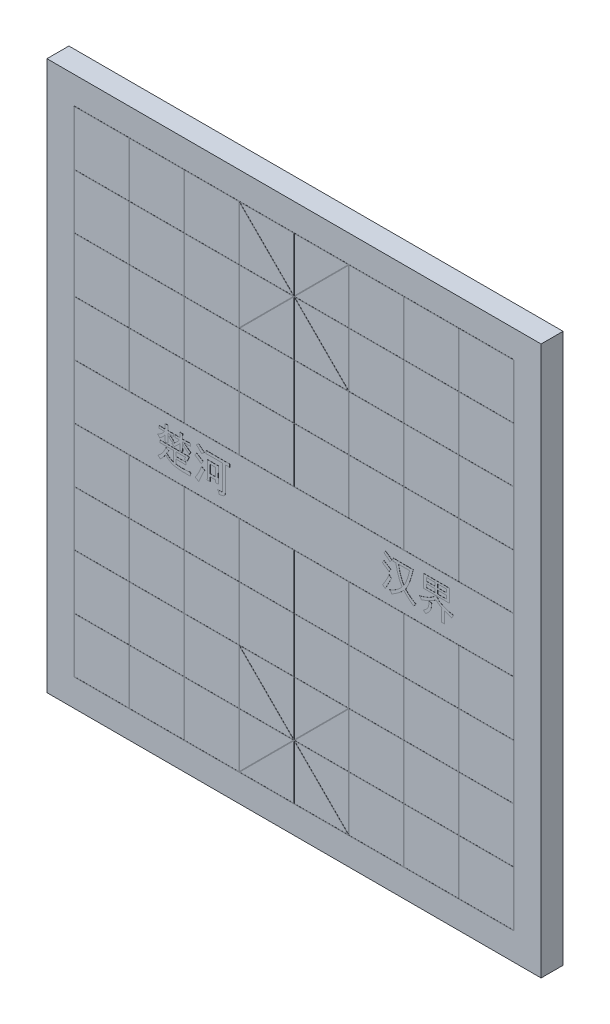
from build123d import *

# Parameters (mm, degrees)
SKETCH_1_W                  = 315
SKETCH_1_H                  = 350
BOARD315X350X14_DEPTH       = 14
SKETCH_2_W                  = 280
SKETCH_2_H                  = 0.32
TEN_RANKS_DEPTH             = 0.05
SKETCH_3_W                  = 0.32
SKETCH_3_H                  = 315
SKETCH_3_H_2                = 140
NINE_FILES_WITH_RIVER_DEPTH = 0.06
PALACE_DIAGONALS_1_DEPTH    = 0.07
PALACE_DIAGONALS_1_2_DEPTH  = 0.07
SKETCH_6_W                  = 3.368421053
SKETCH_6_H                  = 5.239766081
SKETCH_6_W_2                = 5.520467836
SKETCH_6_H_2                = 2.152046783
SKETCH_6_W_3                = 5.333333333
RIVER_NAME_DEPTH            = 0.09


with BuildPart() as part:
    # 草图1 → Board315x350x14 (new body)
    with BuildSketch(Plane.XY):
        Rectangle(SKETCH_1_W, SKETCH_1_H)
    extrude(amount=-BOARD315X350X14_DEPTH)

    # 草图2 → Ten_ranks (add)
    with BuildSketch(Plane.XY):
        with Locations((0, -157.5)):
            Rectangle(SKETCH_2_W, SKETCH_2_H)
        with Locations((0, -122.5)):
            Rectangle(SKETCH_2_W, SKETCH_2_H)
        with Locations((0, -87.5)):
            Rectangle(SKETCH_2_W, SKETCH_2_H)
        with Locations((0, -52.5)):
            Rectangle(SKETCH_2_W, SKETCH_2_H)
        with Locations((0, -17.5)):
            Rectangle(SKETCH_2_W, SKETCH_2_H)
        with Locations((0, 17.5)):
            Rectangle(SKETCH_2_W, SKETCH_2_H)
        with Locations((0, 52.5)):
            Rectangle(SKETCH_2_W, SKETCH_2_H)
        with Locations((0, 87.5)):
            Rectangle(SKETCH_2_W, SKETCH_2_H)
        with Locations((0, 122.5)):
            Rectangle(SKETCH_2_W, SKETCH_2_H)
        with Locations((0, 157.5)):
            Rectangle(SKETCH_2_W, SKETCH_2_H)
    extrude(amount=TEN_RANKS_DEPTH)

    # 草图3 → Nine_files_with_river (add)
    with BuildSketch(Plane.XY):
        with Locations((-140, 0)):
            Rectangle(SKETCH_3_W, SKETCH_3_H)
        with Locations((-105, -87.5)):
            Rectangle(SKETCH_3_W, SKETCH_3_H_2)
        with Locations((-105, 87.5)):
            Rectangle(SKETCH_3_W, SKETCH_3_H_2)
        with Locations((-70, -87.5)):
            Rectangle(SKETCH_3_W, SKETCH_3_H_2)
        with Locations((-70, 87.5)):
            Rectangle(SKETCH_3_W, SKETCH_3_H_2)
        with Locations((-35, -87.5)):
            Rectangle(SKETCH_3_W, SKETCH_3_H_2)
        with Locations((-35, 87.5)):
            Rectangle(SKETCH_3_W, SKETCH_3_H_2)
        with Locations((0, -87.5)):
            Rectangle(SKETCH_3_W, SKETCH_3_H_2)
        with Locations((0, 87.5)):
            Rectangle(SKETCH_3_W, SKETCH_3_H_2)
        with Locations((35, -87.5)):
            Rectangle(SKETCH_3_W, SKETCH_3_H_2)
        with Locations((35, 87.5)):
            Rectangle(SKETCH_3_W, SKETCH_3_H_2)
        with Locations((70, -87.5)):
            Rectangle(SKETCH_3_W, SKETCH_3_H_2)
        with Locations((70, 87.5)):
            Rectangle(SKETCH_3_W, SKETCH_3_H_2)
        with Locations((105, -87.5)):
            Rectangle(SKETCH_3_W, SKETCH_3_H_2)
        with Locations((105, 87.5)):
            Rectangle(SKETCH_3_W, SKETCH_3_H_2)
        with Locations((140, 0)):
            Rectangle(SKETCH_3_W, SKETCH_3_H)
    extrude(amount=NINE_FILES_WITH_RIVER_DEPTH)

    # 草图4 → Palace_diagonals_-1 (add)
    with BuildSketch(Plane.XY):
        Polygon((-34.88, -87.38), (35.12, -157.38), (34.88, -157.62), (-35.12, -87.62), align=None)
        Polygon((-34.88, 157.62), (35.12, 87.62), (34.88, 87.38), (-35.12, 157.38), align=None)
    extrude(amount=PALACE_DIAGONALS_1_DEPTH)

    # 草图5 → Palace_diagonals_1 2 (add)
    with BuildSketch(Plane.XY):
        Polygon((-34.88, -157.62), (35.12, -87.62), (34.88, -87.38), (-35.12, -157.38), align=None)
        Polygon((-34.88, 87.38), (35.12, 157.38), (34.88, 157.62), (-35.12, 87.62), align=None)
    extrude(amount=PALACE_DIAGONALS_1_2_DEPTH)

    # 草图6 → River_name (add)
    # profile 1 of 17: a face of its own
    with BuildSketch(Plane.XY):
        with BuildLine():
            add(Edge.make_bspline(
                [(-81.076023392, -4.538011696), (-80.918838992, -4.704279949), (-80.609895785, -5.031077313), (-80.113938961, -5.476849668), (-79.602153553, -5.875387865), (-79.072875726, -6.227058076), (-78.529933039, -6.532911545), (-77.983776496, -6.812454116), (-77.428812322, -7.052146489), (-77.052261693, -7.185379838), (-76.865497076, -7.251461988)],
                knots=[0, 0, 0, 0, 1.083854979, 2.130298131, 3.15622576, 4.1551638, 5.138259552, 6.107651827, 7.061417897, 8, 8, 8, 8], degree=3))
            Line((-76.865497076, -7.251461988), (-76.865497076, -0.795321637))
            Line((-76.865497076, -0.795321637), (-82.198830409, -0.795321637))
            add(Edge.make_bspline(
                [(-82.198830409, -0.795321637), (-82.425250764, -0.796952955), (-82.89316566, -0.800324198), (-83.618630967, -0.819044106), (-84.390444509, -0.845280571), (-84.920409319, -0.874077806), (-85.192982456, -0.888888889)],
                knots=[0, 0, 0, 0, 0.90691056, 1.874199695, 2.906651827, 4, 4, 4, 4], degree=3))
            Line((-85.192982456, -0.888888889), (-85.192982456, 0.701754386))
            add(Edge.make_bspline(
                [(-85.192982456, 0.701754386), (-84.717182231, 0.674894579), (-83.751079454, 0.620356283), (-82.78346659, 0.612283909), (-82.292397661, 0.608187135)],
                knots=[0, 0, 0, 0, 0.984988836, 2, 2, 2, 2], degree=3))
            Line((-82.292397661, 0.608187135), (-66.666666667, 0.608187135))
            add(Edge.make_bspline(
                [(-66.666666667, 0.608187135), (-66.76505846, 0.357245342), (-66.964039464, -0.150242609), (-67.266065071, -0.769404074), (-67.509984669, -1.287017822), (-67.678478207, -1.715653592), (-67.838157208, -2.177813477), (-67.929684983, -2.50098667), (-67.976608187, -2.666666667)],
                knots=[0, 0, 0, 0, 1.373075694, 2.776816742, 3.509105374, 4.288551293, 5.122597964, 6, 6, 6, 6], degree=3))
            add(Edge.make_bspline(
                [(-67.976608187, -2.666666667), (-68.129758153, -2.606438489), (-68.430468653, -2.48818025), (-68.881667404, -2.336401565), (-69.320724529, -2.206759319), (-69.611959942, -2.138597214), (-69.754385965, -2.105263158)],
                knots=[0, 0, 0, 0, 1.057928849, 2.077247046, 3.059695204, 4, 4, 4, 4], degree=3))
            add(Edge.make_bspline(
                [(-69.754385965, -2.105263158), (-69.692859522, -2.00907752), (-69.566417078, -1.811407272), (-69.40136835, -1.492807978), (-69.237241675, -1.155320261), (-69.146147176, -0.917384152), (-69.099415205, -0.795321637)],
                knots=[0, 0, 0, 0, 0.933170902, 1.917751207, 2.931795083, 4, 4, 4, 4], degree=3))
            Line((-69.099415205, -0.795321637), (-75.18128655, -0.795321637))
            Line((-75.18128655, -0.795321637), (-75.18128655, -3.415204678))
            Line((-75.18128655, -3.415204678), (-71.438596491, -3.415204678))
            add(Edge.make_bspline(
                [(-71.438596491, -3.415204678), (-71.001815612, -3.410863485), (-70.127717882, -3.402175771), (-69.25522659, -3.348494513), (-68.81871345, -3.321637427)],
                knots=[0, 0, 0, 0, 0.999386829, 2, 2, 2, 2], degree=3))
            Line((-68.81871345, -3.321637427), (-68.81871345, -4.912280702))
            add(Edge.make_bspline(
                [(-68.81871345, -4.912280702), (-69.247137009, -4.885431575), (-70.088451481, -4.832706745), (-70.931357328, -4.823320116), (-71.34502924, -4.81871345)],
                knots=[0, 0, 0, 0, 1.018462352, 2, 2, 2, 2], degree=3))
            Line((-71.34502924, -4.81871345), (-75.18128655, -4.81871345))
            Line((-75.18128655, -4.81871345), (-75.18128655, -7.625730994))
            add(Edge.make_bspline(
                [(-75.18128655, -7.625730994), (-74.889139051, -7.655750597), (-74.281114826, -7.718228099), (-73.333549315, -7.792324849), (-72.315851145, -7.858350306), (-71.421650745, -7.903477431), (-70.658960653, -7.923843707), (-70.040695614, -7.919240287), (-69.383246033, -7.89800223), (-68.688843216, -7.859635022), (-67.956366348, -7.803715962), (-67.185843011, -7.730175399), (-66.377029696, -7.640868711), (-65.82560029, -7.568922874), (-65.543859649, -7.532163743)],
                knots=[0, 0, 0, 0, 1.093655063, 2.276140567, 3.539214212, 4.891518649, 5.61012469, 6.38015826, 7.19360737, 8.059562295, 8.969847214, 9.929109227, 10.941924227, 12, 12, 12, 12], degree=3))
            add(Edge.make_bspline(
                [(-65.543859649, -7.532163743), (-65.60249192, -7.716393964), (-65.717807058, -8.078729125), (-65.853208531, -8.623563756), (-65.950695369, -9.157504086), (-65.991598383, -9.510679352), (-66.011695906, -9.684210526)],
                knots=[0, 0, 0, 0, 1.051050117, 2.067154947, 3.05030475, 4, 4, 4, 4], degree=3))
            add(Edge.make_bspline(
                [(-66.011695906, -9.684210526), (-66.339751677, -9.690453346), (-66.979662379, -9.702630688), (-67.917671846, -9.712664497), (-68.809476903, -9.717290165), (-69.657443801, -9.710757988), (-70.459120787, -9.692464786), (-71.217068412, -9.669921036), (-71.928621004, -9.634271005), (-72.597699006, -9.593984261), (-73.228525577, -9.541575399), (-73.828197678, -9.479401491), (-74.399176485, -9.407666503), (-74.939539589, -9.32320445), (-75.452361033, -9.23543077), (-75.934582415, -9.129677729), (-76.390278218, -9.021999629), (-76.947819019, -8.854856319), (-77.598904715, -8.626749516), (-78.333038351, -8.318132005), (-79.00728355, -7.97299931), (-79.629561535, -7.592170836), (-80.202006795, -7.166785188), (-80.742287273, -6.704509334), (-81.25933873, -6.206921602), (-81.573159267, -5.843566717), (-81.730994152, -5.660818713)],
                knots=[0, 0, 0, 0, 1.402670375, 2.736070708, 4.010139731, 5.215104651, 6.361036552, 7.438122247, 8.456592414, 9.406579707, 10.30346069, 11.16238365, 11.983761855, 12.763186773, 13.500371464, 14.207416242, 14.873343268, 15.501487313, 16.694697388, 17.821011009, 18.903201405, 19.929708892, 20.936148111, 21.948482172, 22.968196652, 24, 24, 24, 24], degree=3))
            add(Edge.make_bspline(
                [(-81.730994152, -5.660818713), (-81.827656686, -5.818910126), (-82.024459345, -6.140780545), (-82.354693502, -6.614540093), (-82.705746522, -7.100314443), (-83.093738735, -7.59296597), (-83.526690342, -8.097534915), (-84.022419511, -8.613733812), (-84.578476895, -9.151650595), (-84.983292076, -9.502482807), (-85.192982456, -9.684210526)],
                knots=[0, 0, 0, 0, 0.833832048, 1.697662549, 2.598246569, 3.531234619, 4.519242547, 5.589376796, 6.751320307, 8, 8, 8, 8], degree=3))
            add(Edge.make_bspline(
                [(-85.192982456, -9.684210526), (-85.304619884, -9.561407536), (-85.527327781, -9.31642522), (-85.890340476, -8.97520368), (-86.277784959, -8.659774116), (-86.552464234, -8.469554922), (-86.69005848, -8.374269006)],
                knots=[0, 0, 0, 0, 0.99797104, 1.990873804, 2.993574591, 4, 4, 4, 4], degree=3))
            add(Edge.make_bspline(
                [(-86.69005848, -8.374269006), (-86.543290334, -8.278977805), (-86.249010309, -8.087912526), (-85.829367551, -7.769597867), (-85.415778189, -7.439406064), (-85.027832379, -7.074901409), (-84.643474414, -6.699699925), (-84.280657785, -6.2967321), (-83.934019302, -5.871539438), (-83.487807301, -5.284959939), (-82.983561113, -4.520577811), (-82.447308343, -3.580719121), (-81.990480735, -2.622893805), (-81.754493628, -1.96419119), (-81.637426901, -1.637426901)],
                knots=[0, 0, 0, 0, 0.734038604, 1.471796874, 2.209156937, 2.953573237, 3.704213022, 4.462637796, 5.227279587, 6.005762103, 7.554503478, 9.065400907, 10.544225927, 12, 12, 12, 12], degree=3))
            add(Edge.make_bspline(
                [(-81.637426901, -1.637426901), (-81.504257504, -1.716311823), (-81.221707344, -1.883684716), (-80.758193197, -2.116050309), (-80.235636443, -2.348129804), (-79.865954316, -2.495819418), (-79.67251462, -2.573099415)],
                knots=[0, 0, 0, 0, 0.852125962, 1.807985404, 2.853007474, 4, 4, 4, 4], degree=3))
            add(Edge.make_bspline(
                [(-79.67251462, -2.573099415), (-79.796414966, -2.718624909), (-80.048094049, -3.01423121), (-80.405407854, -3.488551829), (-80.752616657, -3.996593104), (-80.966989693, -4.355477242), (-81.076023392, -4.538011696)],
                knots=[0, 0, 0, 0, 0.94820521, 1.926091625, 2.945175639, 4, 4, 4, 4], degree=3))
        make_face()
    # profile 2 of 17: a face of its own
    with BuildSketch(Plane.XY):
        with BuildLine():
            add(Edge.make_bspline(
                [(-72.65497076, 9.590643275), (-72.656691519, 9.707330816), (-72.660373026, 9.956979862), (-72.679138583, 10.354391901), (-72.705879969, 10.799354636), (-72.733828136, 11.110886282), (-72.748538012, 11.274853801)],
                knots=[0, 0, 0, 0, 0.829928519, 1.775603988, 2.829240308, 4, 4, 4, 4], degree=3))
            Line((-72.748538012, 11.274853801), (-70.877192982, 11.274853801))
            add(Edge.make_bspline(
                [(-70.877192982, 11.274853801), (-70.891974347, 11.122448187), (-70.920612959, 10.827165201), (-70.94737579, 10.393704127), (-70.965676506, 9.984703477), (-70.969105829, 9.718882854), (-70.970760234, 9.590643275)],
                knots=[0, 0, 0, 0, 1.088827181, 2.109582004, 3.088007521, 4, 4, 4, 4], degree=3))
            Line((-70.970760234, 9.590643275), (-70.970760234, 8.280701754))
            Line((-70.970760234, 8.280701754), (-68.912280702, 8.280701754))
            add(Edge.make_bspline(
                [(-68.912280702, 8.280701754), (-68.413138292, 8.285040755), (-67.414384424, 8.293722832), (-66.417036707, 8.347411877), (-65.918128655, 8.374269006)],
                knots=[0, 0, 0, 0, 0.999530368, 2, 2, 2, 2], degree=3))
            Line((-65.918128655, 8.374269006), (-65.918128655, 6.783625731))
            add(Edge.make_bspline(
                [(-65.918128655, 6.783625731), (-66.417036707, 6.81048286), (-67.414384424, 6.864171905), (-68.413138292, 6.872853982), (-68.912280702, 6.877192982)],
                knots=[0, 0, 0, 0, 1.000469632, 2, 2, 2, 2], degree=3))
            Line((-68.912280702, 6.877192982), (-70.970760234, 6.877192982))
            Line((-70.970760234, 6.877192982), (-70.970760234, 4.81871345))
            add(Edge.make_bspline(
                [(-70.970760234, 4.81871345), (-70.969263569, 4.512588109), (-70.966326481, 3.911841096), (-70.948197683, 3.02925847), (-70.922676273, 2.181139055), (-70.892166885, 1.628136773), (-70.877192982, 1.356725146)],
                knots=[0, 0, 0, 0, 1.060566986, 2.081279671, 3.058298631, 4, 4, 4, 4], degree=3))
            Line((-70.877192982, 1.356725146), (-72.748538012, 1.356725146))
            add(Edge.make_bspline(
                [(-72.748538012, 1.356725146), (-72.741947827, 1.483810257), (-72.729304985, 1.727614819), (-72.705829701, 2.076206875), (-72.694313178, 2.394110488), (-72.679362321, 2.679323013), (-72.668454712, 2.932301033), (-72.663216905, 3.153019988), (-72.653436281, 3.34120411), (-72.654494662, 3.456781158), (-72.65497076, 3.50877193)],
                knots=[0, 0, 0, 0, 1.417679315, 2.719726043, 3.89192347, 4.961278854, 5.901498894, 6.712645773, 7.42090111, 8, 8, 8, 8], degree=3))
            Line((-72.65497076, 3.50877193), (-72.65497076, 5.005847953))
            add(Edge.make_bspline(
                [(-72.65497076, 5.005847953), (-72.92509571, 4.734181886), (-73.446399853, 4.209903596), (-74.019430956, 3.609394938), (-74.392577235, 3.209938539), (-74.606968652, 2.997949836), (-74.843543315, 2.767817779), (-75.106083369, 2.519753247), (-75.392700744, 2.254203929), (-75.704739052, 1.968881548), (-76.044120901, 1.66969597), (-76.27756345, 1.46304121), (-76.397660819, 1.356725146)],
                knots=[0, 0, 0, 0, 2.197562491, 4.240994517, 4.761279205, 5.332914896, 5.970217027, 6.654562335, 7.404775425, 8.211559296, 9.079914855, 10, 10, 10, 10], degree=3))
            add(Edge.make_bspline(
                [(-76.397660819, 1.356725146), (-76.482697262, 1.466625103), (-76.65887358, 1.694313012), (-76.988624029, 1.999476103), (-77.367633939, 2.301938025), (-77.652450779, 2.480080999), (-77.801169591, 2.573099415)],
                knots=[0, 0, 0, 0, 0.890671052, 1.845269405, 2.874894574, 4, 4, 4, 4], degree=3))
            add(Edge.make_bspline(
                [(-77.801169591, 2.573099415), (-77.527393902, 2.728769519), (-76.990872877, 3.033837817), (-76.241026276, 3.54589692), (-75.538705126, 4.065921954), (-74.905811479, 4.615663257), (-74.337547662, 5.171941295), (-73.850079107, 5.734550151), (-73.440414971, 6.296013262), (-73.226375046, 6.687677458), (-73.122807018, 6.877192982)],
                knots=[0, 0, 0, 0, 1.172568205, 2.297893936, 3.379576269, 4.425894929, 5.41774288, 6.338988801, 7.196282396, 8, 8, 8, 8], degree=3))
            add(Edge.make_bspline(
                [(-73.122807018, 6.877192982), (-73.315730119, 6.875571039), (-73.713195503, 6.872229466), (-74.327771781, 6.853501668), (-74.977183758, 6.827431239), (-75.421609939, 6.798457905), (-75.649122807, 6.783625731)],
                knots=[0, 0, 0, 0, 0.915613415, 1.886371486, 2.917980746, 4, 4, 4, 4], degree=3))
            Line((-75.649122807, 6.783625731), (-75.649122807, 8.374269006))
            add(Edge.make_bspline(
                [(-75.649122807, 8.374269006), (-75.462034628, 8.359709162), (-75.119192849, 8.333028037), (-74.651196997, 8.306242718), (-74.276945771, 8.287021598), (-74.058493651, 8.282597127), (-73.964912281, 8.280701754)],
                knots=[0, 0, 0, 0, 1.334731458, 2.445914585, 3.334254831, 4, 4, 4, 4], degree=3))
            Line((-73.964912281, 8.280701754), (-72.65497076, 8.280701754))
            Line((-72.65497076, 8.280701754), (-72.65497076, 9.590643275))
        make_face()
    # profile 3 of 17: a face of its own
    with BuildSketch(Plane.XY):
        with BuildLine():
            Line((-82.011695906, 8.280701754), (-82.011695906, 9.684210526))
            add(Edge.make_bspline(
                [(-82.011695906, 9.684210526), (-82.013351728, 9.799745706), (-82.016813931, 10.041321451), (-82.035787719, 10.421405089), (-82.062128232, 10.836392416), (-82.09049704, 11.124757968), (-82.105263158, 11.274853801)],
                knots=[0, 0, 0, 0, 0.86982674, 1.818745106, 2.864645002, 4, 4, 4, 4], degree=3))
            Line((-82.105263158, 11.274853801), (-80.140350877, 11.274853801))
            add(Edge.make_bspline(
                [(-80.140350877, 11.274853801), (-80.170336771, 11.148200544), (-80.230718548, 10.893162337), (-80.28047026, 10.499433842), (-80.324133469, 10.096404764), (-80.326357056, 9.822963766), (-80.32748538, 9.684210526)],
                knots=[0, 0, 0, 0, 0.97210764, 1.957506618, 2.963569555, 4, 4, 4, 4], degree=3))
            Line((-80.32748538, 9.684210526), (-80.32748538, 8.280701754))
            Line((-80.32748538, 8.280701754), (-79.298245614, 8.280701754))
            add(Edge.make_bspline(
                [(-79.298245614, 8.280701754), (-78.869534204, 8.28476428), (-78.026562288, 8.292752393), (-77.185333639, 8.347409125), (-76.771929825, 8.374269006)],
                knots=[0, 0, 0, 0, 1.017142807, 2, 2, 2, 2], degree=3))
            Line((-76.771929825, 8.374269006), (-76.771929825, 6.783625731))
            add(Edge.make_bspline(
                [(-76.771929825, 6.783625731), (-76.998290057, 6.798397184), (-77.434651673, 6.826872571), (-78.06670864, 6.853395842), (-78.651252789, 6.872045793), (-79.025617313, 6.875527607), (-79.204678363, 6.877192982)],
                knots=[0, 0, 0, 0, 1.117897709, 2.155005972, 3.117527049, 4, 4, 4, 4], degree=3))
            Line((-79.204678363, 6.877192982), (-80.32748538, 6.877192982))
            Line((-80.32748538, 6.877192982), (-80.32748538, 3.134502924))
            add(Edge.make_bspline(
                [(-80.32748538, 3.134502924), (-80.325829716, 3.003953027), (-80.322370664, 2.731205053), (-80.303499382, 2.303760049), (-80.27735925, 1.841417847), (-80.248716956, 1.52184251), (-80.233918129, 1.356725146)],
                knots=[0, 0, 0, 0, 0.879753943, 1.838003015, 2.882944952, 4, 4, 4, 4], degree=3))
            Line((-80.233918129, 1.356725146), (-82.105263158, 1.356725146))
            add(Edge.make_bspline(
                [(-82.105263158, 1.356725146), (-82.090615051, 1.532252791), (-82.06326241, 1.860018341), (-82.036670161, 2.316502128), (-82.017479401, 2.702324698), (-82.01349162, 2.935800569), (-82.011695906, 3.040935673)],
                knots=[0, 0, 0, 0, 1.252731217, 2.339244833, 3.252155408, 4, 4, 4, 4], degree=3))
            Line((-82.011695906, 3.040935673), (-82.011695906, 5.192982456))
            add(Edge.make_bspline(
                [(-82.011695906, 5.192982456), (-82.109742748, 5.052275426), (-82.310323116, 4.764422524), (-82.642515791, 4.341427773), (-83.016834621, 3.924172252), (-83.418867172, 3.497495131), (-83.86747394, 3.069761809), (-84.358944813, 2.630948418), (-84.89654136, 2.178957296), (-85.277422016, 1.88332772), (-85.473684211, 1.730994152)],
                knots=[0, 0, 0, 0, 0.836953442, 1.712206395, 2.622878646, 3.572007085, 4.572859263, 5.646938937, 6.787502275, 8, 8, 8, 8], degree=3))
            add(Edge.make_bspline(
                [(-85.473684211, 1.730994152), (-85.570816563, 1.85419497), (-85.766127579, 2.101923727), (-86.102578282, 2.442065064), (-86.472984766, 2.758031412), (-86.741586896, 2.946025331), (-86.877192982, 3.040935673)],
                knots=[0, 0, 0, 0, 0.97539016, 1.961287235, 2.970738395, 4, 4, 4, 4], degree=3))
            add(Edge.make_bspline(
                [(-86.877192982, 3.040935673), (-86.675079659, 3.153392315), (-86.270168307, 3.378686574), (-85.680794668, 3.752386899), (-85.100965392, 4.151407091), (-84.528424746, 4.580094969), (-83.973316789, 5.059047299), (-83.445614054, 5.60341883), (-82.941388114, 6.210576569), (-82.635676778, 6.651822794), (-82.479532164, 6.877192982)],
                knots=[0, 0, 0, 0, 0.940808752, 1.88480471, 2.83770753, 3.8039367, 4.793350854, 5.816940978, 6.8849844, 8, 8, 8, 8], degree=3))
            Line((-82.479532164, 6.877192982), (-83.789473684, 6.877192982))
            add(Edge.make_bspline(
                [(-83.789473684, 6.877192982), (-83.939656981, 6.875480856), (-84.259741031, 6.87183182), (-84.768040971, 6.853081514), (-85.335397518, 6.826270245), (-85.732488149, 6.798332453), (-85.941520468, 6.783625731)],
                knots=[0, 0, 0, 0, 0.8365234, 1.782873351, 2.832883257, 4, 4, 4, 4], degree=3))
            Line((-85.941520468, 6.783625731), (-85.941520468, 8.374269006))
            add(Edge.make_bspline(
                [(-85.941520468, 8.374269006), (-85.683965972, 8.359478794), (-85.185198539, 8.330836794), (-84.459590561, 8.304390294), (-83.78148173, 8.285776445), (-83.34475154, 8.282350876), (-83.134502924, 8.280701754)],
                knots=[0, 0, 0, 0, 1.102078905, 2.134232082, 3.101790691, 4, 4, 4, 4], degree=3))
            Line((-83.134502924, 8.280701754), (-82.011695906, 8.280701754))
        make_face()
    # profile 4 of 17: a face of its own
    with BuildSketch(Plane.XY):
        with BuildLine():
            add(Edge.make_bspline(
                [(-69.754385965, 6.502923977), (-69.415537986, 6.229348739), (-68.750730898, 5.692604333), (-67.749927692, 4.911665634), (-66.746203105, 4.157735052), (-66.071142944, 3.663991698), (-65.730994152, 3.415204678)],
                knots=[0, 0, 0, 0, 1.030286493, 2.021383645, 3.003016322, 4, 4, 4, 4], degree=3))
            add(Edge.make_bspline(
                [(-65.730994152, 3.415204678), (-65.9107426, 3.174291186), (-66.257687191, 2.709287821), (-66.596808092, 2.238549508), (-66.760233918, 2.011695906)],
                knots=[0, 0, 0, 0, 1.036179567, 2, 2, 2, 2], degree=3))
            add(Edge.make_bspline(
                [(-66.760233918, 2.011695906), (-66.969122685, 2.189814766), (-67.369558643, 2.531265372), (-67.944228493, 3.015136785), (-68.470635657, 3.44252109), (-69.101835874, 3.947882713), (-69.868408236, 4.555468473), (-70.475358573, 5.040304049), (-70.783625731, 5.286549708)],
                knots=[0, 0, 0, 0, 0.952436521, 1.825803449, 2.606337136, 3.304847205, 4.631144853, 6, 6, 6, 6], degree=3))
            add(Edge.make_bspline(
                [(-70.783625731, 5.286549708), (-70.604212722, 5.496478841), (-70.259136708, 5.900248383), (-69.918106616, 6.307440479), (-69.754385965, 6.502923977)],
                knots=[0, 0, 0, 0, 1.039846303, 2, 2, 2, 2], degree=3))
        make_face()
    # profile 5 of 17: a face of its own
    with BuildSketch(Plane.XY):
        with BuildLine():
            add(Edge.make_bspline(
                [(-78.736842105, 6.315789474), (-78.574354004, 6.158161709), (-78.241402357, 5.835169296), (-77.695261005, 5.367434655), (-77.104613236, 4.875766171), (-76.70104996, 4.530427015), (-76.49122807, 4.350877193)],
                knots=[0, 0, 0, 0, 0.909958287, 1.864580294, 2.889745856, 4, 4, 4, 4], degree=3))
            add(Edge.make_bspline(
                [(-76.49122807, 4.350877193), (-76.600076242, 4.28482366), (-76.820221711, 4.151230365), (-77.129852537, 3.90782721), (-77.427636544, 3.63067594), (-77.613183877, 3.425860663), (-77.707602339, 3.321637427)],
                knots=[0, 0, 0, 0, 0.953760315, 1.92898059, 2.946131614, 4, 4, 4, 4], degree=3))
            add(Edge.make_bspline(
                [(-77.707602339, 3.321637427), (-77.812693809, 3.425626169), (-78.014173036, 3.624991269), (-78.303803964, 3.910757888), (-78.575540187, 4.162294273), (-78.900120543, 4.464202929), (-79.310963862, 4.799445582), (-79.677131392, 4.999631634), (-79.859649123, 5.099415205)],
                knots=[0, 0, 0, 0, 0.949162292, 1.819714617, 2.611979086, 3.325844628, 4.667056119, 6, 6, 6, 6], degree=3))
            add(Edge.make_bspline(
                [(-79.859649123, 5.099415205), (-79.670717453, 5.292975614), (-79.28514623, 5.687993157), (-78.922029812, 6.103753571), (-78.736842105, 6.315789474)],
                knots=[0, 0, 0, 0, 0.980009181, 2, 2, 2, 2], degree=3))
        make_face()
    # profile 6 of 17: a face of its own
    with BuildSketch(Plane.XY):
        with BuildLine():
            add(Edge.make_bspline(
                [(-48.140350877, 4.912280702), (-48.14730627, 4.754027608), (-48.16202789, 4.419072842), (-48.184902119, 3.886669546), (-48.195572354, 3.296213316), (-48.211155535, 2.647081308), (-48.221111816, 1.940098554), (-48.226621843, 1.174210363), (-48.235955075, 0.349451546), (-48.234612534, -0.220053387), (-48.233918129, -0.514619883)],
                knots=[0, 0, 0, 0, 0.700374111, 1.482395324, 2.355986645, 3.311274716, 4.35328148, 5.482046318, 6.697632363, 8, 8, 8, 8], degree=3))
            add(Edge.make_bspline(
                [(-48.233918129, -0.514619883), (-48.234635665, -0.80456594), (-48.236005013, -1.357899425), (-48.226778802, -2.146849422), (-48.221211063, -2.85498064), (-48.211543654, -3.481118205), (-48.196063842, -4.025123302), (-48.18537245, -4.487417654), (-48.163790435, -4.867402947), (-48.147501739, -5.093655754), (-48.140350877, -5.192982456)],
                knots=[0, 0, 0, 0, 1.486826903, 2.837462664, 4.045937822, 5.118259066, 6.048568124, 6.836764901, 7.489330947, 8, 8, 8, 8], degree=3))
            Line((-48.140350877, -5.192982456), (-50.011695906, -5.192982456))
            Line((-50.011695906, -5.192982456), (-50.011695906, -3.695906433))
            Line((-50.011695906, -3.695906433), (-53.380116959, -3.695906433))
            Line((-53.380116959, -3.695906433), (-53.380116959, -6.409356725))
            Line((-53.380116959, -6.409356725), (-55.251461988, -6.409356725))
            add(Edge.make_bspline(
                [(-55.251461988, -6.409356725), (-55.235393696, -6.299742252), (-55.198464107, -6.047816451), (-55.164096985, -5.617325747), (-55.134546432, -5.08692129), (-55.10493523, -4.457404106), (-55.092544025, -3.729390509), (-55.070878372, -2.902427878), (-55.067664676, -1.975882021), (-55.065476092, -1.324377108), (-55.064327485, -0.98245614)],
                knots=[0, 0, 0, 0, 0.489231648, 1.124395993, 1.906390679, 2.835898043, 3.907675587, 5.122280597, 6.489723435, 8, 8, 8, 8], degree=3))
            add(Edge.make_bspline(
                [(-55.064327485, -0.98245614), (-55.063615217, -0.631287627), (-55.062251582, 0.041023561), (-55.071520775, 1.004404225), (-55.077064825, 1.877717851), (-55.086789282, 2.659789744), (-55.102417201, 3.351665318), (-55.112941313, 3.952525958), (-55.135129865, 4.463022129), (-55.150812574, 4.772516141), (-55.157894737, 4.912280702)],
                knots=[0, 0, 0, 0, 1.429417562, 2.736616134, 3.921565378, 4.984318107, 5.920211374, 6.738581004, 7.430355148, 8, 8, 8, 8], degree=3))
            Line((-55.157894737, 4.912280702), (-48.140350877, 4.912280702))
        make_face()
        with Locations((-51.695906433, 0.608187135)):
            Rectangle(SKETCH_6_W, SKETCH_6_H, mode=Mode.SUBTRACT)
    # profile 7 of 17: a face of its own
    with BuildSketch(Plane.XY):
        with BuildLine():
            add(Edge.make_bspline(
                [(-43.555555556, 9.497076023), (-43.348771152, 9.498678804), (-42.927051599, 9.501947541), (-42.283585997, 9.520411985), (-41.616847224, 9.546645446), (-41.165495495, 9.575798754), (-40.935672515, 9.590643275)],
                knots=[0, 0, 0, 0, 0.946389898, 1.930083307, 2.946022819, 4, 4, 4, 4], degree=3))
            Line((-40.935672515, 9.590643275), (-40.935672515, 7.719298246))
            add(Edge.make_bspline(
                [(-40.935672515, 7.719298246), (-41.216337787, 7.733988246), (-41.746350504, 7.761729075), (-42.495019932, 7.78837926), (-43.150005297, 7.807335896), (-43.555545317, 7.811119483), (-43.742690058, 7.812865497)],
                knots=[0, 0, 0, 0, 1.20068751, 2.267397185, 3.200454974, 4, 4, 4, 4], degree=3))
            Line((-43.742690058, 7.812865497), (-43.742690058, -8))
            add(Edge.make_bspline(
                [(-43.742690058, -8), (-43.744754316, -8.112231929), (-43.74871002, -8.32730013), (-43.794939739, -8.633977673), (-43.866296484, -8.910250145), (-43.967421666, -9.157105369), (-44.097993757, -9.374989652), (-44.265694473, -9.557105223), (-44.457288449, -9.712577757), (-44.68276333, -9.833430021), (-44.936195766, -9.936594275), (-45.219638242, -10.031331923), (-45.53370935, -10.126043184), (-45.880728535, -10.215186889), (-46.2595803, -10.301651482), (-46.671335108, -10.380657872), (-47.113858067, -10.456843021), (-47.42059546, -10.502661955), (-47.578947368, -10.526315789)],
                knots=[0, 0, 0, 0, 1.040886063, 1.99463287, 2.871059874, 3.683434383, 4.46309974, 5.214611699, 5.969785871, 6.742490452, 7.578780862, 8.507799969, 9.51523784, 10.623051707, 11.832511428, 13.121477588, 14.513974723, 16, 16, 16, 16], degree=3))
            add(Edge.make_bspline(
                [(-47.578947368, -10.526315789), (-47.590087699, -10.446304881), (-47.612906449, -10.282418462), (-47.678653475, -10.035031378), (-47.763186922, -9.777195283), (-47.884857087, -9.51431701), (-48.026984503, -9.240217672), (-48.193101242, -8.955795709), (-48.387551577, -8.664219749), (-48.533185464, -8.47283331), (-48.608187135, -8.374269006)],
                knots=[0, 0, 0, 0, 0.80235467, 1.643463825, 2.54041336, 3.496498953, 4.518579014, 5.609675789, 6.768979442, 8, 8, 8, 8], degree=3))
            add(Edge.make_bspline(
                [(-48.608187135, -8.374269006), (-48.444182856, -8.382089184), (-48.132434967, -8.396954185), (-47.68754469, -8.404404457), (-47.290180114, -8.415149681), (-46.938981689, -8.40876605), (-46.634920765, -8.405337327), (-46.377085918, -8.387614384), (-46.166525774, -8.36431978), (-45.995509628, -8.335787786), (-45.855825827, -8.286086879), (-45.738529137, -8.211559419), (-45.640051146, -8.111759655), (-45.557715984, -7.987785519), (-45.503050792, -7.836219117), (-45.454861754, -7.664205437), (-45.43436821, -7.46560864), (-45.429478889, -7.325399187), (-45.426900585, -7.251461988)],
                knots=[0, 0, 0, 0, 1.999754923, 3.801238509, 5.419559242, 6.840721775, 8.079221447, 9.122792232, 9.986708725, 10.660024564, 11.229825311, 11.780185239, 12.337337785, 12.926609892, 13.577196232, 14.290488722, 15.098516731, 16, 16, 16, 16], degree=3))
            Line((-45.426900585, -7.251461988), (-45.426900585, 7.812865497))
            Line((-45.426900585, 7.812865497), (-52.725146199, 7.812865497))
            add(Edge.make_bspline(
                [(-52.725146199, 7.812865497), (-52.982754517, 7.811243898), (-53.513038891, 7.807905851), (-54.332069726, 7.789223845), (-55.197436209, 7.763025021), (-55.789801067, 7.734120537), (-56.093567251, 7.719298246)],
                knots=[0, 0, 0, 0, 0.91729495, 1.888243292, 2.917085867, 4, 4, 4, 4], degree=3))
            Line((-56.093567251, 7.719298246), (-56.093567251, 9.590643275))
            add(Edge.make_bspline(
                [(-56.093567251, 9.590643275), (-55.789801067, 9.575820983), (-55.197436209, 9.546916499), (-54.332069726, 9.520717676), (-53.513038891, 9.50203567), (-52.982754517, 9.498697623), (-52.725146199, 9.497076023)],
                knots=[0, 0, 0, 0, 1.082914133, 2.111756708, 3.08270505, 4, 4, 4, 4], degree=3))
            Line((-52.725146199, 9.497076023), (-43.555555556, 9.497076023))
        make_face()
    # profile 8 of 17: a face of its own
    with BuildSketch(Plane.XY):
        with BuildLine():
            add(Edge.make_bspline(
                [(-56.842105263, -1.918128655), (-56.921248162, -2.048310714), (-57.084798701, -2.317334798), (-57.32629734, -2.740858032), (-57.576709816, -3.193834878), (-57.828359625, -3.682133644), (-58.09351773, -4.198265104), (-58.353630959, -4.752599304), (-58.630681633, -5.333373276), (-58.900366991, -5.941114248), (-59.17028551, -6.548881987), (-59.430355626, -7.136285977), (-59.671969095, -7.695151307), (-59.902701203, -8.223342226), (-60.115961351, -8.724214413), (-60.316719923, -9.195612546), (-60.505671383, -9.635639512), (-60.622154286, -9.920851705), (-60.678362573, -10.058479532)],
                knots=[0, 0, 0, 0, 0.811846193, 1.677697987, 2.59788625, 3.569825092, 4.604956525, 5.68979795, 6.832612211, 8.033929668, 9.232736763, 10.376545352, 11.4572571, 12.477343075, 13.448111564, 14.358258662, 15.207785294, 16, 16, 16, 16], degree=3))
            add(Edge.make_bspline(
                [(-60.678362573, -10.058479532), (-60.828926881, -9.933524993), (-61.142054364, -9.673657956), (-61.67186219, -9.317324389), (-62.269711717, -8.971878186), (-62.700744123, -8.763098268), (-62.923976608, -8.65497076)],
                knots=[0, 0, 0, 0, 0.88338702, 1.837173493, 2.879868125, 4, 4, 4, 4], degree=3))
            add(Edge.make_bspline(
                [(-62.923976608, -8.65497076), (-62.850013252, -8.570451418), (-62.692333925, -8.390268234), (-62.466954504, -8.082321847), (-62.222951021, -7.731933954), (-61.968438401, -7.333021114), (-61.697383508, -6.888608012), (-61.414234699, -6.397557389), (-61.119579613, -5.858541552), (-60.713945801, -5.08695469), (-60.222916304, -4.108078626), (-59.685997196, -2.944586815), (-59.208752446, -1.817270327), (-58.938927007, -1.068033512), (-58.807017544, -0.701754386)],
                knots=[0, 0, 0, 0, 0.449479419, 0.958226014, 1.526570542, 2.159042457, 2.852294307, 3.610676417, 4.42826316, 5.311644354, 7.100766268, 8.812136057, 10.44155013, 12, 12, 12, 12], degree=3))
            add(Edge.make_bspline(
                [(-58.807017544, -0.701754386), (-58.638007339, -0.821886547), (-58.308378766, -1.056185965), (-57.812668961, -1.37984254), (-57.326091518, -1.665148299), (-57.001041161, -1.835052618), (-56.842105263, -1.918128655)],
                knots=[0, 0, 0, 0, 1.075525833, 2.097648753, 3.06983058, 4, 4, 4, 4], degree=3))
        make_face()
    # profile 9 of 17: a face of its own
    with BuildSketch(Plane.XY):
        with BuildLine():
            add(Edge.make_bspline(
                [(-62.081871345, 5.099415205), (-61.699369984, 4.869783145), (-60.949820538, 4.419796293), (-59.849789445, 3.753793692), (-58.797600291, 3.110098665), (-58.112611932, 2.686563483), (-57.777777778, 2.479532164)],
                knots=[0, 0, 0, 0, 1.062483224, 2.082041508, 3.062468727, 4, 4, 4, 4], degree=3))
            add(Edge.make_bspline(
                [(-57.777777778, 2.479532164), (-57.912434732, 2.327405458), (-58.173171004, 2.032842506), (-58.522567404, 1.579928723), (-58.830697334, 1.142631006), (-59.00417252, 0.8450644), (-59.087719298, 0.701754386)],
                knots=[0, 0, 0, 0, 1.101478626, 2.132793144, 3.100741022, 4, 4, 4, 4], degree=3))
            add(Edge.make_bspline(
                [(-59.087719298, 0.701754386), (-59.391140651, 0.948996558), (-60.004755172, 1.448998899), (-60.985037587, 2.141760358), (-62.020369223, 2.804976068), (-62.743917843, 3.209774007), (-63.111111111, 3.415204678)],
                knots=[0, 0, 0, 0, 0.966020704, 1.953601236, 2.961474281, 4, 4, 4, 4], degree=3))
            add(Edge.make_bspline(
                [(-63.111111111, 3.415204678), (-63.018350713, 3.542405735), (-62.829455626, 3.801434966), (-62.570995851, 4.21409181), (-62.312919688, 4.644191144), (-62.159768517, 4.945937944), (-62.081871345, 5.099415205)],
                knots=[0, 0, 0, 0, 0.955618659, 1.945999296, 2.955275082, 4, 4, 4, 4], degree=3))
        make_face()
    # profile 10 of 17: a face of its own
    with BuildSketch(Plane.XY):
        with BuildLine():
            add(Edge.make_bspline(
                [(-60.865497076, 10.900584795), (-60.552606109, 10.661597996), (-59.921714523, 10.179721635), (-58.98487175, 9.426324843), (-58.049273806, 8.636717773), (-57.433509121, 8.089154554), (-57.122807018, 7.812865497)],
                knots=[0, 0, 0, 0, 0.973424002, 1.962744457, 2.97204306, 4, 4, 4, 4], degree=3))
            add(Edge.make_bspline(
                [(-57.122807018, 7.812865497), (-57.287458284, 7.677292543), (-57.603202115, 7.417310797), (-58.047974697, 7.03130777), (-58.446797596, 6.669803213), (-58.691062316, 6.429746916), (-58.807017544, 6.315789474)],
                knots=[0, 0, 0, 0, 1.135291277, 2.177093587, 3.134645685, 4, 4, 4, 4], degree=3))
            add(Edge.make_bspline(
                [(-58.807017544, 6.315789474), (-59.050299108, 6.596695089), (-59.54497889, 7.167878234), (-60.353850726, 7.993591797), (-61.232224095, 8.807252103), (-61.857602857, 9.326663329), (-62.175438596, 9.590643275)],
                knots=[0, 0, 0, 0, 0.947622127, 1.926859975, 2.94636973, 4, 4, 4, 4], degree=3))
            add(Edge.make_bspline(
                [(-62.175438596, 9.590643275), (-61.953614271, 9.790440865), (-61.494183789, 10.204250772), (-61.07980408, 10.663218147), (-60.865497076, 10.900584795)],
                knots=[0, 0, 0, 0, 0.965649143, 2, 2, 2, 2], degree=3))
        make_face()
    # profile 11 of 17: a face of its own
    with BuildSketch(Plane.XY):
        with BuildLine():
            add(Edge.make_bspline(
                [(64.918128655, 8.093567251), (64.614518365, 8.066723534), (64.023023237, 8.014426466), (63.429313554, 8.004722828), (63.140350877, 8)],
                knots=[0, 0, 0, 0, 1.026585938, 2, 2, 2, 2], degree=3))
            Line((63.140350877, 8), (63.140350877, 9.777777778))
            add(Edge.make_bspline(
                [(63.140350877, 9.777777778), (63.503036898, 9.762984015), (64.205185811, 9.734343748), (65.222999194, 9.708030641), (66.17024482, 9.689282488), (66.777914131, 9.685857696), (67.070175439, 9.684210526)],
                knots=[0, 0, 0, 0, 1.108009546, 2.145072197, 3.107864069, 4, 4, 4, 4], degree=3))
            Line((67.070175439, 9.684210526), (76.052631579, 9.684210526))
            add(Edge.make_bspline(
                [(76.052631579, 9.684210526), (75.910097289, 9.053638875), (75.628430641, 7.807545727), (75.13836787, 5.97756945), (74.617836276, 4.203715455), (74.147060527, 2.767139347), (73.742951919, 1.655664756), (73.429271693, 0.851340447), (73.095702439, 0.075528451), (72.749144128, -0.675079827), (72.386170065, -1.399203628), (72.003712851, -2.096739724), (71.607122088, -2.768961949), (71.326141169, -3.201312528), (71.187134503, -3.415204678)],
                knots=[0, 0, 0, 0, 1.656244692, 3.272959005, 4.852846051, 6.392465632, 7.145238736, 7.882818173, 8.604107478, 9.30858716, 10.000837214, 10.678992741, 11.346472292, 12, 12, 12, 12], degree=3))
            add(Edge.make_bspline(
                [(71.187134503, -3.415204678), (71.413070428, -3.663921462), (71.873073569, -4.170306191), (72.627115736, -4.891666775), (73.445032653, -5.596649528), (74.316026855, -6.278724788), (75.224181052, -6.923885546), (76.145424467, -7.525011498), (77.07506022, -8.070354823), (77.705415942, -8.398779992), (78.01754386, -8.561403509)],
                knots=[0, 0, 0, 0, 0.937369684, 1.908474713, 2.90941951, 3.949473437, 4.994127246, 6.016895932, 7.01804311, 8, 8, 8, 8], degree=3))
            add(Edge.make_bspline(
                [(78.01754386, -8.561403509), (77.875549124, -8.650526189), (77.578109637, -8.837213423), (77.17825509, -9.22474344), (76.783816278, -9.694691067), (76.550014742, -10.055579194), (76.426900585, -10.245614035)],
                knots=[0, 0, 0, 0, 0.857773309, 1.796796562, 2.839847081, 4, 4, 4, 4], degree=3))
            add(Edge.make_bspline(
                [(76.426900585, -10.245614035), (76.314464451, -10.172260837), (76.08178732, -10.020462557), (75.728697899, -9.773600548), (75.358853641, -9.503027817), (74.96950869, -9.210798098), (74.561239221, -8.89744686), (74.138166285, -8.555198509), (73.696105895, -8.193405724), (73.09013007, -7.684268061), (72.352763274, -7.034434209), (71.521605914, -6.237876386), (70.75720731, -5.445344611), (70.291569187, -4.898467212), (70.064327485, -4.631578947)],
                knots=[0, 0, 0, 0, 0.567755752, 1.174922816, 1.821830582, 2.50580882, 3.233822663, 3.998346282, 4.807182973, 5.649782547, 7.345711959, 8.962839316, 10.51779842, 12, 12, 12, 12], degree=3))
            add(Edge.make_bspline(
                [(70.064327485, -4.631578947), (69.808986228, -4.910985497), (69.293392707, -5.475172454), (68.449254786, -6.268078588), (67.554677885, -7.040062716), (66.601877298, -7.779848218), (65.597722349, -8.487591023), (64.566512912, -9.191657693), (63.493881128, -9.86961492), (62.761287414, -10.30615315), (62.391812865, -10.526315789)],
                knots=[0, 0, 0, 0, 0.934756085, 1.887490435, 2.858780131, 3.853157918, 4.865939198, 5.893293907, 6.937508924, 8, 8, 8, 8], degree=3))
            add(Edge.make_bspline(
                [(62.391812865, -10.526315789), (62.333145102, -10.396059009), (62.206060086, -10.113899199), (61.91646813, -9.704481254), (61.536934647, -9.272718301), (61.24037902, -8.992096421), (61.081871345, -8.842105263)],
                knots=[0, 0, 0, 0, 0.795557765, 1.723322413, 2.783125862, 4, 4, 4, 4], degree=3))
            add(Edge.make_bspline(
                [(61.081871345, -8.842105263), (61.225615356, -8.792640678), (61.520296587, -8.691236212), (61.964563682, -8.508516599), (62.424896866, -8.299917527), (62.902292079, -8.067939114), (63.397027122, -7.811393302), (63.904462648, -7.522060546), (64.43054688, -7.210832165), (64.97044044, -6.877417708), (65.510593841, -6.514561873), (66.048396944, -6.132115403), (66.572212617, -5.721435938), (67.085576277, -5.286851294), (67.590653906, -4.831485809), (68.083557312, -4.350043959), (68.570033669, -3.850358563), (68.87945817, -3.498573058), (69.035087719, -3.321637427)],
                knots=[0, 0, 0, 0, 0.74558257, 1.528475441, 2.355274086, 3.224556258, 4.131919404, 5.088517068, 6.089501354, 7.130444097, 8.200725623, 9.281040697, 10.366973689, 11.464729188, 12.580055463, 13.702098383, 14.844236991, 16, 16, 16, 16], degree=3))
            add(Edge.make_bspline(
                [(69.035087719, -3.321637427), (68.791167493, -2.940463411), (68.29953524, -2.172189936), (67.665225982, -0.944734883), (67.084533618, 0.33804791), (66.672603893, 1.460727095), (66.364671376, 2.393872963), (66.140948396, 3.12687298), (65.921818757, 3.8868516), (65.711514243, 4.674218907), (65.503361332, 5.489747945), (65.298137615, 6.33238511), (65.105400275, 7.20429146), (64.9811559, 7.794276826), (64.918128655, 8.093567251)],
                knots=[0, 0, 0, 0, 1.333425465, 2.687579351, 4.068558495, 5.482276738, 6.210242334, 6.965348377, 7.741365706, 8.541804998, 9.367734969, 10.22258734, 11.098346127, 12, 12, 12, 12], degree=3))
        make_face()
        with BuildLine():
            add(Edge.make_bspline(
                [(66.695906433, 8.093567251), (66.767458623, 7.649111), (66.913546706, 6.74166482), (67.226955441, 5.369200274), (67.61985508, 3.955206176), (68.01150816, 2.766636583), (68.346033003, 1.823899608), (68.609122317, 1.161595145), (68.862938219, 0.544113349), (69.119752583, -0.024378233), (69.374271066, -0.546304635), (69.635541523, -1.016079216), (69.889009102, -1.442189292), (70.070873692, -1.70081206), (70.157894737, -1.824561404)],
                knots=[0, 0, 0, 0, 1.531647797, 3.127164799, 4.787612469, 6.524258381, 7.384713078, 8.191349547, 8.949130548, 9.656409324, 10.313913733, 10.92443882, 11.48535084, 12, 12, 12, 12], degree=3))
            add(Edge.make_bspline(
                [(70.157894737, -1.824561404), (70.237483531, -1.701602109), (70.402026201, -1.447394831), (70.636370096, -1.040714817), (70.87246252, -0.598818167), (71.110886244, -0.120047973), (71.353829804, 0.394140213), (71.591911056, 0.947979355), (71.83368139, 1.536349706), (72.080076239, 2.158053665), (72.321901796, 2.811897157), (72.557262942, 3.492193267), (72.781417296, 4.199208505), (73.005060443, 4.928155162), (73.213509406, 5.68522443), (73.424392834, 6.464809729), (73.619736872, 7.270938323), (73.744131146, 7.817339225), (73.807017544, 8.093567251)],
                knots=[0, 0, 0, 0, 0.662098224, 1.368828504, 2.121168921, 2.926933262, 3.786672225, 4.691859358, 5.651994357, 6.662520773, 7.715086576, 8.803474877, 9.916652424, 11.068163259, 12.250387064, 13.466499504, 14.719211776, 16, 16, 16, 16], degree=3))
            Line((73.807017544, 8.093567251), (67.444444444, 8.093567251))
            Line((67.444444444, 8.093567251), (66.695906433, 8.093567251))
        make_face(mode=Mode.SUBTRACT)
    # profile 12 of 17: a face of its own
    with BuildSketch(Plane.XY):
        with BuildLine():
            add(Edge.make_bspline(
                [(62.204678363, -2.011695906), (62.021213398, -2.358349118), (61.659115101, -3.042526272), (61.119711556, -4.053184103), (60.604982702, -5.041156958), (60.105581771, -6.002644376), (59.619895038, -6.935705635), (59.156479062, -7.844746112), (58.708000044, -8.725405627), (58.417770353, -9.305158214), (58.274853801, -9.590643275)],
                knots=[0, 0, 0, 0, 1.102556141, 2.17607597, 3.220403458, 4.234189222, 5.221815669, 6.1774259, 7.102517712, 8, 8, 8, 8], degree=3))
            add(Edge.make_bspline(
                [(58.274853801, -9.590643275), (58.158038369, -9.480633177), (57.915460353, -9.252187065), (57.493782948, -8.948216555), (57.021070345, -8.646242059), (56.676539311, -8.467417302), (56.497076023, -8.374269006)],
                knots=[0, 0, 0, 0, 0.889531715, 1.84719463, 2.878621984, 4, 4, 4, 4], degree=3))
            add(Edge.make_bspline(
                [(56.497076023, -8.374269006), (56.714656509, -8.073491821), (57.154432482, -7.465557804), (57.769157214, -6.511304835), (58.370052649, -5.522272956), (58.929103047, -4.50169357), (59.459117892, -3.49156902), (59.926150965, -2.514204006), (60.349229489, -1.595584997), (60.590952585, -0.992694731), (60.707602339, -0.701754386)],
                knots=[0, 0, 0, 0, 1.015234469, 2.052002616, 3.103794643, 4.180075538, 5.234346784, 6.223582313, 7.142743542, 8, 8, 8, 8], degree=3))
            add(Edge.make_bspline(
                [(60.707602339, -0.701754386), (60.830494205, -0.836435705), (61.068570601, -1.097351614), (61.445728219, -1.447055738), (61.817485323, -1.756510732), (62.078314258, -1.928413815), (62.204678363, -2.011695906)],
                knots=[0, 0, 0, 0, 1.095833255, 2.12293979, 3.090618405, 4, 4, 4, 4], degree=3))
        make_face()
    # profile 13 of 17: a face of its own
    with BuildSketch(Plane.XY):
        with BuildLine():
            add(Edge.make_bspline(
                [(57.339181287, 5.473684211), (57.48620545, 5.391068057), (57.792132291, 5.219160949), (58.264100432, 4.939029719), (58.77402216, 4.63562395), (59.317760347, 4.298795362), (59.895660832, 3.931251669), (60.509332726, 3.534835563), (61.160992414, 3.114629007), (61.603281782, 2.818656546), (61.830409357, 2.666666667)],
                knots=[0, 0, 0, 0, 0.764003645, 1.589733384, 2.486334728, 3.452124738, 4.487267652, 5.589054314, 6.76191406, 8, 8, 8, 8], degree=3))
            add(Edge.make_bspline(
                [(61.830409357, 2.666666667), (61.721517448, 2.539625259), (61.50148502, 2.282919047), (61.194569418, 1.871147849), (60.895059918, 1.438405697), (60.708558627, 1.135816133), (60.614035088, 0.98245614)],
                knots=[0, 0, 0, 0, 0.964977276, 1.949881263, 2.960948327, 4, 4, 4, 4], degree=3))
            add(Edge.make_bspline(
                [(60.614035088, 0.98245614), (60.270363626, 1.257723308), (59.587651143, 1.804548846), (58.517937232, 2.553414235), (57.432212585, 3.255544765), (56.683081511, 3.674406923), (56.30994152, 3.883040936)],
                knots=[0, 0, 0, 0, 1.01632395, 2.018954511, 3.013247051, 4, 4, 4, 4], degree=3))
            add(Edge.make_bspline(
                [(56.30994152, 3.883040936), (56.413634846, 4.021009182), (56.615128399, 4.289104664), (56.89392067, 4.690187687), (57.134963771, 5.082338089), (57.272458838, 5.345822644), (57.339181287, 5.473684211)],
                knots=[0, 0, 0, 0, 1.091446258, 2.120863445, 3.088108439, 4, 4, 4, 4], degree=3))
        make_face()
    # profile 14 of 17: a face of its own
    with BuildSketch(Plane.XY):
        with BuildLine():
            add(Edge.make_bspline(
                [(58.461988304, 11.18128655), (59.143139679, 10.709632913), (60.502647527, 9.76826093), (61.825375683, 8.775874758), (62.485380117, 8.280701754)],
                knots=[0, 0, 0, 0, 1.002055818, 2, 2, 2, 2], degree=3))
            add(Edge.make_bspline(
                [(62.485380117, 8.280701754), (62.365505603, 8.142843954), (62.132931077, 7.875379159), (61.809212713, 7.473711964), (61.523667569, 7.08071641), (61.352295173, 6.817826544), (61.269005848, 6.69005848)],
                knots=[0, 0, 0, 0, 1.093547714, 2.121646469, 3.087094531, 4, 4, 4, 4], degree=3))
            add(Edge.make_bspline(
                [(61.269005848, 6.69005848), (60.956579088, 6.979875471), (60.336670448, 7.554922425), (59.361442938, 8.352981444), (58.370659341, 9.10369957), (57.681491828, 9.554075417), (57.339181287, 9.777777778)],
                knots=[0, 0, 0, 0, 1.021457097, 2.026747262, 3.019882393, 4, 4, 4, 4], degree=3))
            add(Edge.make_bspline(
                [(57.339181287, 9.777777778), (57.468856216, 9.910428329), (57.712505773, 10.159668857), (58.03066472, 10.526957422), (58.280106987, 10.860766196), (58.404941566, 11.080755934), (58.461988304, 11.18128655)],
                knots=[0, 0, 0, 0, 1.233921901, 2.318447566, 3.231566423, 4, 4, 4, 4], degree=3))
        make_face()
    # profile 15 of 17: a face of its own
    with BuildSketch(Plane.XY):
        with BuildLine():
            add(Edge.make_bspline(
                [(99.16374269, 10.994152047), (99.156750835, 10.902902094), (99.14179882, 10.707764939), (99.119428043, 10.398359812), (99.108341396, 10.052693166), (99.092972196, 9.672746275), (99.082972229, 9.256842441), (99.077474694, 8.806293937), (99.06813783, 8.32116318), (99.069480822, 7.986143172), (99.070175439, 7.812865497)],
                knots=[0, 0, 0, 0, 0.689948931, 1.475449224, 2.338289237, 3.296851912, 4.342192473, 5.47442499, 6.693732443, 8, 8, 8, 8], degree=3))
            Line((99.070175439, 7.812865497), (99.070175439, 5.754385965))
            add(Edge.make_bspline(
                [(99.070175439, 5.754385965), (99.071844963, 5.539517315), (99.075354996, 5.087774332), (99.094335908, 4.373872006), (99.120576666, 3.590524249), (99.148971139, 3.044361913), (99.16374269, 2.760233918)],
                knots=[0, 0, 0, 0, 0.860657691, 1.809459284, 2.860423177, 4, 4, 4, 4], degree=3))
            Line((99.16374269, 2.760233918), (82.602339181, 2.760233918))
            add(Edge.make_bspline(
                [(82.602339181, 2.760233918), (82.61711793, 3.046672094), (82.645654524, 3.599761547), (82.67213493, 4.401588625), (82.690751933, 5.14438119), (82.694239178, 5.620378533), (82.695906433, 5.847953216)],
                knots=[0, 0, 0, 0, 1.11403706, 2.151117416, 3.116047866, 4, 4, 4, 4], degree=3))
            Line((82.695906433, 5.847953216), (82.695906433, 7.812865497))
            add(Edge.make_bspline(
                [(82.695906433, 7.812865497), (82.694445793, 8.101665121), (82.691606044, 8.663144045), (82.673404651, 9.482194281), (82.648395493, 10.254132248), (82.617361219, 10.752782199), (82.602339181, 10.994152047)],
                knots=[0, 0, 0, 0, 1.08870883, 2.116647704, 3.088369594, 4, 4, 4, 4], degree=3))
            Line((82.602339181, 10.994152047), (99.16374269, 10.994152047))
        make_face()
        with Locations((94.438596491, 5.146198831)):
            Rectangle(SKETCH_6_W_2, SKETCH_6_H_2, mode=Mode.SUBTRACT)
        with Locations((94.438596491, 8.608187135)):
            Rectangle(SKETCH_6_W_2, SKETCH_6_H_2, mode=Mode.SUBTRACT)
        with Locations((87.233918128, 8.608187135)):
            Rectangle(SKETCH_6_W_3, SKETCH_6_H_2, mode=Mode.SUBTRACT)
        with Locations((87.233918128, 5.146198831)):
            Rectangle(SKETCH_6_W_3, SKETCH_6_H_2, mode=Mode.SUBTRACT)
    # profile 16 of 17: a face of its own
    with BuildSketch(Plane.XY):
        with BuildLine():
            add(Edge.make_bspline(
                [(91.678362573, 1.169590643), (91.83197861, 1.05925968), (92.147550382, 0.832607968), (92.657660499, 0.516855517), (93.203242095, 0.19619433), (93.793842845, -0.112856972), (94.420977896, -0.423472698), (95.092362199, -0.722365356), (95.801243193, -1.025750653), (96.543114882, -1.313990891), (97.292010809, -1.589509421), (98.029534883, -1.834980195), (98.743435348, -2.051097011), (99.433990314, -2.233554904), (100.099594226, -2.393471738), (100.744527168, -2.511786596), (101.364664605, -2.609413939), (101.771828625, -2.64787528), (101.970760234, -2.666666667)],
                knots=[0, 0, 0, 0, 0.81847395, 1.681382239, 2.595616496, 3.557457209, 4.566021162, 5.624612973, 6.738181282, 7.903536132, 9.069395086, 10.192087125, 11.267806446, 12.297567423, 13.283655442, 14.23004763, 15.135239229, 16, 16, 16, 16], degree=3))
            add(Edge.make_bspline(
                [(101.970760234, -2.666666667), (101.835170554, -2.808669644), (101.567534144, -3.088965067), (101.216438283, -3.548459865), (100.908423762, -4.028407566), (100.74306354, -4.368740901), (100.660818713, -4.538011696)],
                knots=[0, 0, 0, 0, 1.025413474, 2.024032947, 3.01721789, 4, 4, 4, 4], degree=3))
            add(Edge.make_bspline(
                [(100.660818713, -4.538011696), (100.271811369, -4.439549758), (99.494143473, -4.242713659), (98.341922437, -3.889611676), (97.200512383, -3.492780485), (96.451463648, -3.19179596), (96.076023392, -3.040935673)],
                knots=[0, 0, 0, 0, 0.997291518, 1.993693972, 2.994393802, 4, 4, 4, 4], degree=3))
            add(Edge.make_bspline(
                [(96.076023392, -3.040935673), (96.060905677, -3.14244646), (96.02854221, -3.359757157), (96.004305874, -3.711777544), (95.986494382, -4.109261338), (95.983849033, -4.390124752), (95.98245614, -4.538011696)],
                knots=[0, 0, 0, 0, 0.819973545, 1.755370317, 2.818103715, 4, 4, 4, 4], degree=3))
            Line((95.98245614, -4.538011696), (95.98245614, -7.438596491))
            add(Edge.make_bspline(
                [(95.98245614, -7.438596491), (95.986796128, -7.906557585), (95.995480743, -8.842980056), (96.049166282, -9.777902882), (96.076023392, -10.245614035)],
                knots=[0, 0, 0, 0, 0.999465752, 2, 2, 2, 2], degree=3))
            Line((96.076023392, -10.245614035), (94.01754386, -10.245614035))
            add(Edge.make_bspline(
                [(94.01754386, -10.245614035), (94.032530786, -10.023885271), (94.063111152, -9.571454495), (94.088272062, -8.881526641), (94.106718292, -8.167596058), (94.109628396, -7.68465692), (94.111111111, -7.438596491)],
                knots=[0, 0, 0, 0, 0.949289244, 1.936995731, 2.948886776, 4, 4, 4, 4], degree=3))
            Line((94.111111111, -7.438596491), (94.111111111, -4.912280702))
            add(Edge.make_bspline(
                [(94.111111111, -4.912280702), (94.107069729, -4.514745388), (94.099133406, -3.734079585), (94.044403752, -2.955302816), (94.01754386, -2.573099415)],
                knots=[0, 0, 0, 0, 1.018451972, 2, 2, 2, 2], degree=3))
            Line((94.01754386, -2.573099415), (95.140350877, -2.573099415))
            add(Edge.make_bspline(
                [(95.140350877, -2.573099415), (94.964956087, -2.506071228), (94.60605312, -2.368914274), (94.072237041, -2.113659809), (93.518745429, -1.827270303), (92.953674004, -1.493829778), (92.372471377, -1.121266668), (91.778358892, -0.708249115), (91.16552429, -0.258567281), (90.762199322, 0.067075085), (90.555555556, 0.233918129)],
                knots=[0, 0, 0, 0, 0.834287199, 1.707166737, 2.628105857, 3.603839237, 4.622223148, 5.696137389, 6.819614738, 8, 8, 8, 8], degree=3))
            add(Edge.make_bspline(
                [(90.555555556, 0.233918129), (90.290915633, 0.042369504), (89.736945973, -0.358598442), (88.822745768, -0.920281163), (87.812016668, -1.500104988), (86.697019903, -2.080530346), (85.482971539, -2.654772111), (84.171183559, -3.210812426), (82.767205254, -3.752757371), (81.792607558, -4.08618105), (81.292397661, -4.257309942)],
                knots=[0, 0, 0, 0, 0.758428107, 1.587614432, 2.490000849, 3.464306184, 4.505899672, 5.608078758, 6.772352242, 8, 8, 8, 8], degree=3))
            add(Edge.make_bspline(
                [(81.292397661, -4.257309942), (81.224554896, -4.116507951), (81.08593558, -3.828815144), (80.800129105, -3.428603487), (80.46793242, -3.032522982), (80.209315358, -2.791097859), (80.076023392, -2.666666667)],
                knots=[0, 0, 0, 0, 0.928391712, 1.896930694, 2.916072127, 4, 4, 4, 4], degree=3))
            add(Edge.make_bspline(
                [(80.076023392, -2.666666667), (80.197461654, -2.640744275), (80.451521426, -2.586512298), (80.846425994, -2.488280661), (81.271716162, -2.374334962), (81.72565186, -2.242187681), (82.207366524, -2.092997704), (82.717733545, -1.925849419), (83.258248981, -1.741776066), (84.011127439, -1.478640142), (84.940269531, -1.123876403), (85.9942238, -0.633595682), (86.980263005, -0.119755259), (87.735495896, 0.358538396), (88.294115398, 0.744877504), (88.672790115, 1.021269814), (89.013090979, 1.290453858), (89.321604501, 1.543086852), (89.590819715, 1.791104728), (89.82158692, 2.02875849), (90.019321041, 2.254072883), (90.129229966, 2.407068341), (90.18128655, 2.479532164)],
                knots=[0, 0, 0, 0, 0.646267406, 1.352049572, 2.117725017, 2.93781387, 3.81260929, 4.742352688, 5.732935971, 6.784483026, 8.893601606, 10.905870907, 12.831605668, 14.676621303, 15.553871961, 16.366788662, 17.116119735, 17.812024565, 18.441747317, 19.019999044, 19.535838408, 20, 20, 20, 20], degree=3))
            add(Edge.make_bspline(
                [(90.18128655, 2.479532164), (90.50059473, 2.32218304), (91.151372956, 2.001491653), (91.81048434, 1.698292399), (92.14619883, 1.543859649)],
                knots=[0, 0, 0, 0, 0.981311811, 2, 2, 2, 2], degree=3))
            Line((92.14619883, 1.543859649), (91.678362573, 1.169590643))
        make_face()
    # profile 17 of 17: a face of its own
    with BuildSketch(Plane.XY):
        with BuildLine():
            add(Edge.make_bspline(
                [(87.935672515, -2.85380117), (87.879108353, -3.079189345), (87.763306272, -3.540619682), (87.70760411, -4.145720011), (87.668921562, -4.661712562), (87.605758379, -5.08888941), (87.528138389, -5.551948732), (87.422119091, -6.046112452), (87.27740862, -6.563292655), (87.062704869, -7.089111323), (86.782289263, -7.620298574), (86.500111946, -8.064869939), (86.230907393, -8.424976899), (85.994370807, -8.708958726), (85.72683676, -9.003318074), (85.428025808, -9.309061489), (85.096114247, -9.623339325), (84.729454997, -9.945022807), (84.335517748, -10.282937266), (84.056256574, -10.505261548), (83.912280702, -10.619883041)],
                knots=[0, 0, 0, 0, 1.374812245, 2.814611169, 3.591007116, 4.44082307, 5.371332088, 6.372758849, 7.434132738, 8.548719792, 9.730358102, 10.989098531, 11.663919652, 12.392991825, 13.17793782, 14.020057461, 14.925357742, 15.885326706, 16.909759172, 18, 18, 18, 18], degree=3))
            add(Edge.make_bspline(
                [(83.912280702, -10.619883041), (83.803831734, -10.484863334), (83.592488599, -10.221739687), (83.242277993, -9.872830374), (82.887799636, -9.562759461), (82.633127014, -9.392888481), (82.50877193, -9.30994152)],
                knots=[0, 0, 0, 0, 1.076401389, 2.097669052, 3.071103428, 4, 4, 4, 4], degree=3))
            add(Edge.make_bspline(
                [(82.50877193, -9.30994152), (82.745323697, -9.158136942), (83.197967382, -8.867657678), (83.813535649, -8.404934291), (84.349751318, -7.957558568), (84.793912342, -7.507159544), (85.157510692, -7.062776677), (85.445528442, -6.624709862), (85.659490297, -6.192568781), (85.789235596, -5.765410823), (85.864246772, -5.358567558), (85.937623132, -4.982993602), (85.985615267, -4.634684156), (86.018558523, -4.300532264), (86.038227736, -3.947870695), (86.057383343, -3.547092569), (86.061183962, -3.081364088), (86.063234426, -2.749832059), (86.064327485, -2.573099415)],
                knots=[0, 0, 0, 0, 1.654678489, 3.166240418, 4.532024977, 5.763482418, 6.885412102, 7.908081843, 8.845176631, 9.714432602, 10.526920825, 11.280793587, 11.967697674, 12.596533418, 13.257656268, 14.047501937, 14.959164986, 16, 16, 16, 16], degree=3))
            add(Edge.make_bspline(
                [(86.064327485, -2.573099415), (86.254908526, -2.602104039), (86.61410423, -2.656770214), (87.11684295, -2.731363411), (87.549485091, -2.799675599), (87.814334003, -2.836795136), (87.935672515, -2.85380117)],
                knots=[0, 0, 0, 0, 1.222487543, 2.304071132, 3.223023106, 4, 4, 4, 4], degree=3))
        make_face()
    extrude(amount=RIVER_NAME_DEPTH)


solid = part.part
